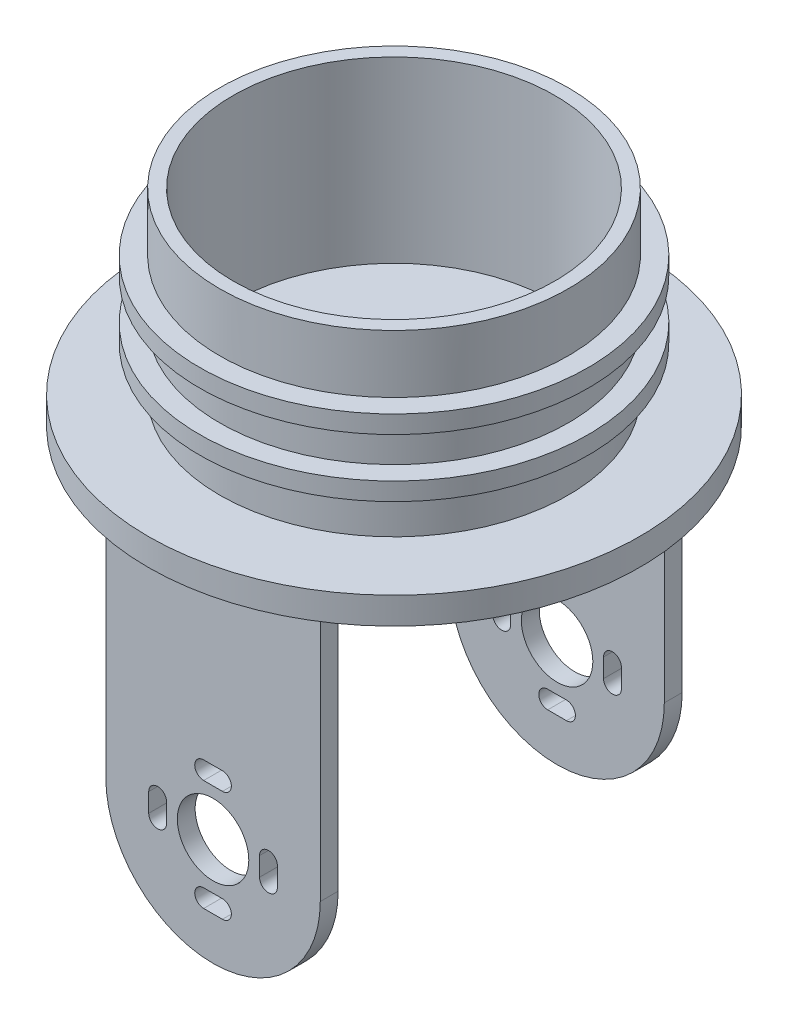
from build123d import *

# Parameters (mm, degrees)
SKETCH_1_R             = 19.5
SKETCH_1_R_2           = 18
EXTRUDE_1_DEPTH        = 20
SKETCH_3_R             = 27.5
EXTRUDE_2_DEPTH        = 3
EXTRUDE_START          = 2
SKETCH_25_R            = 21.75
SKETCH_25_R_2          = 19.5
EXTRUDE_12_DEPTH       = 2
EXTRUDE_START_2        = -1
SKETCH_26_R            = 21.75
SKETCH_26_R_2          = 19.5
EXTRUDE_13_DEPTH       = 2
SKETCH_28_R            = 4
EXTRUDE_14_DEPTH       = 2
PATTERN_LINEAR_1_COUNT = 2
PATTERN_LINEAR_1_PITCH = 38.5


with BuildPart() as part:
    # 草圖1 → 填料-伸長1 (new body)
    with BuildSketch(Plane(origin=(0, 0, 0), x_dir=(1, 0, 0), z_dir=(0, 1, 0))):
        Circle(SKETCH_1_R)
        Circle(SKETCH_1_R_2, mode=Mode.SUBTRACT)
    extrude(amount=EXTRUDE_1_DEPTH)

    # 草圖3 → 填料-伸長2 (add)
    with BuildSketch(Plane.XZ):
        Circle(SKETCH_3_R)
    extrude(amount=EXTRUDE_2_DEPTH)

    # 草圖25 → 填料-伸長12 (add)
    with BuildSketch(Plane(origin=(0, 7, 0), x_dir=(-1, 0, 0), z_dir=(0, -1, 0)).offset(EXTRUDE_START)):
        Circle(SKETCH_25_R)
        Circle(SKETCH_25_R_2, mode=Mode.SUBTRACT)
    extrude(amount=-EXTRUDE_12_DEPTH)

    # 草圖26 → 填料-伸長13 (add)
    with BuildSketch(Plane(origin=(0, 10.5, 0), x_dir=(-1, 0, 0), z_dir=(0, -1, 0)).offset(EXTRUDE_START_2)):
        Circle(SKETCH_26_R)
        Circle(SKETCH_26_R_2, mode=Mode.SUBTRACT)
    extrude(amount=-EXTRUDE_13_DEPTH)

    # 草圖28 → 填料-伸長14 (add)
    with BuildSketch(Plane.XY.offset(-18.25)):
        with BuildLine():
            Line((-12, -3), (12, -3))
            Line((12, -3), (12, -33))
            ThreePointArc((12, -33), (0, -45), (-12, -33))
            Line((-12, -33), (-12, -3))
        make_face()
        with Locations((0, -33)):
            Circle(SKETCH_28_R, mode=Mode.SUBTRACT)
        with BuildLine():
            Line((-1.05, -25.8), (1.05, -25.8))
            ThreePointArc((1.05, -25.8), (2.05, -26.8), (1.05, -27.8))
            Line((1.05, -27.8), (-1.05, -27.8))
            ThreePointArc((-1.05, -27.8), (-2.05, -26.8), (-1.05, -25.8))
        make_face(mode=Mode.SUBTRACT)
        with BuildLine():
            Line((7.2, -31.95), (7.2, -34.05))
            ThreePointArc((7.2, -34.05), (6.2, -35.05), (5.2, -34.05))
            Line((5.2, -34.05), (5.2, -31.95))
            ThreePointArc((5.2, -31.95), (6.2, -30.95), (7.2, -31.95))
        make_face(mode=Mode.SUBTRACT)
        with BuildLine():
            Line((-1.05, -40.2), (1.05, -40.2))
            ThreePointArc((1.05, -40.2), (2.05, -39.2), (1.05, -38.2))
            Line((1.05, -38.2), (-1.05, -38.2))
            ThreePointArc((-1.05, -38.2), (-2.05, -39.2), (-1.05, -40.2))
        make_face(mode=Mode.SUBTRACT)
        with BuildLine():
            Line((-7.2, -31.95), (-7.2, -34.05))
            ThreePointArc((-7.2, -34.05), (-6.2, -35.05), (-5.2, -34.05))
            Line((-5.2, -34.05), (-5.2, -31.95))
            ThreePointArc((-5.2, -31.95), (-6.2, -30.95), (-7.2, -31.95))
        make_face(mode=Mode.SUBTRACT)
    extrude_14 = extrude(amount=-EXTRUDE_14_DEPTH)

    # 直線複製排列1: 填料-伸長14 ×2
    with Locations(*[(0, 0, i * PATTERN_LINEAR_1_PITCH) for i in range(1, PATTERN_LINEAR_1_COUNT)]):
        add(extrude_14)


solid = part.part
